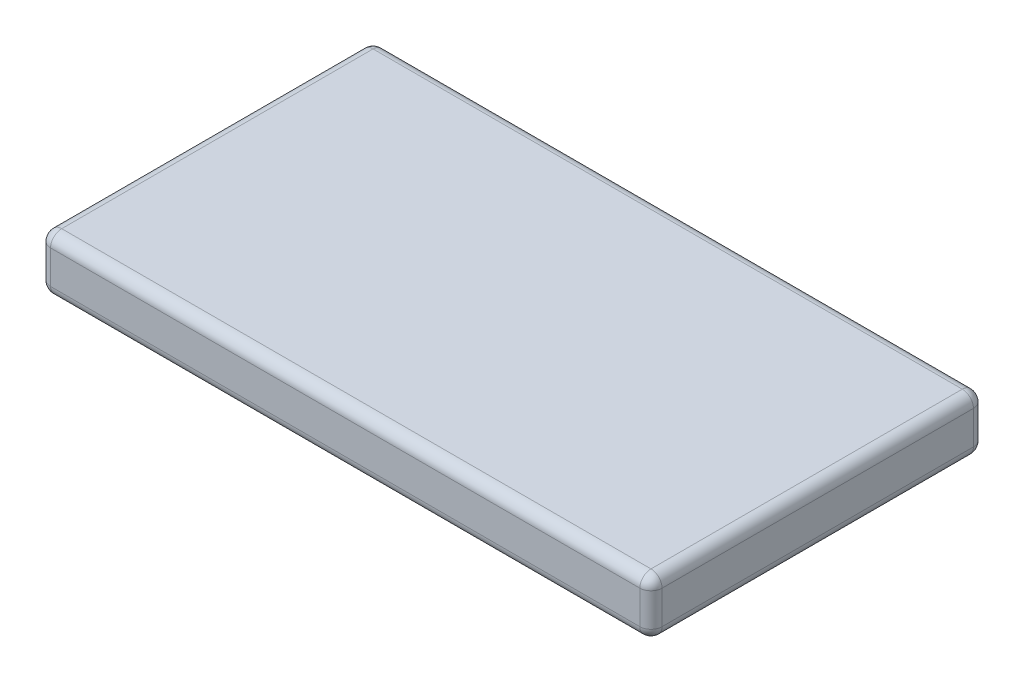
from build123d import *

# Parameters (mm, degrees)
SKETCH1_W   = 55
SKETCH1_H   = 30
SHAPE_DEPTH = 5
FILLETS_R   = 1


with BuildPart() as part:
    # Sketch1 → Shape (new body)
    with BuildSketch(Plane(origin=(0, 0, 0), x_dir=(1, 0, 0), z_dir=(0, 1, 0))):
        Rectangle(SKETCH1_W, SKETCH1_H)
    extrude(amount=SHAPE_DEPTH)

    # Fillets
    fillets_edges = [part.edges().sort_by_distance(p)[0] for p in [
        (-27.5, 0, 0),
        (-27.5, 2.5, -15),
        (0, 0, -15),
        (27.5, 2.5, -15),
        (27.5, 0, 0),
        (-27.5, 2.5, 15),
        (27.5, 2.5, 15),
        (0, 0, 15),
        (0, 5, 15),
        (-27.5, 5, 0),
        (0, 5, -15),
        (27.5, 5, 0),
    ]]
    fillet(fillets_edges, radius=FILLETS_R)


solid = part.part
